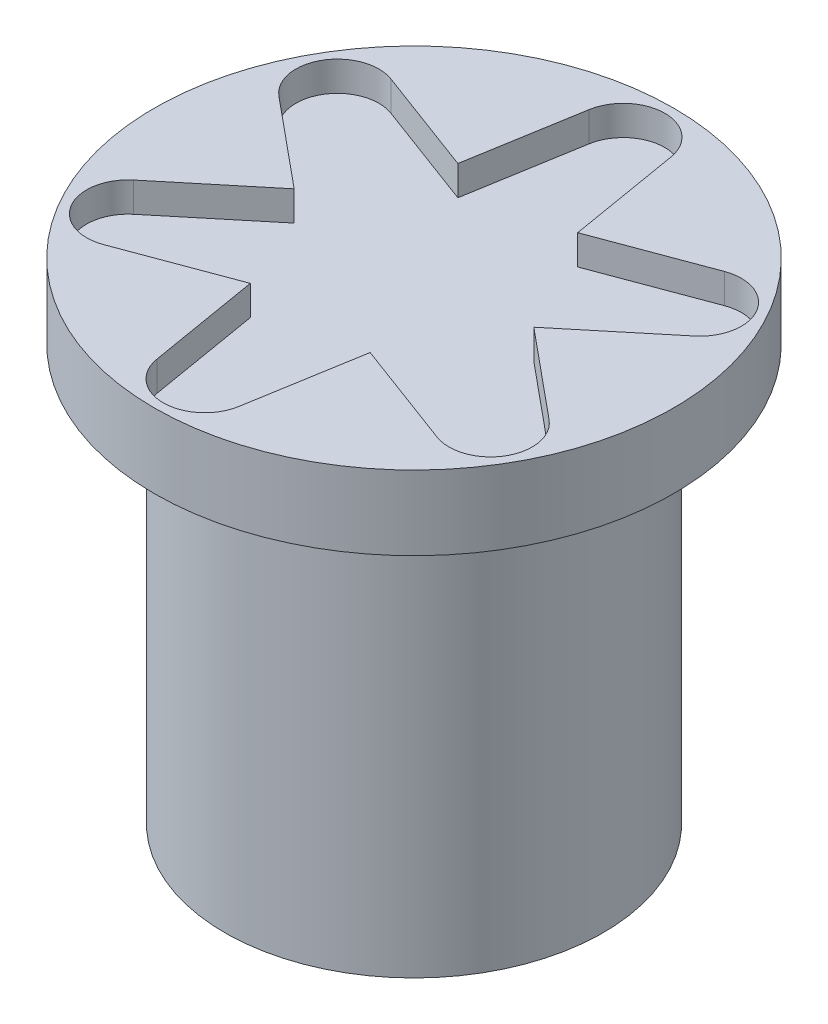
from build123d import *

# Parameters (mm, degrees)
BOSS_EXTRUDE1_DEPTH = 3
BOSS_EXTRUDE2_START = 25
BOSS_EXTRUDE2_DEPTH = 25
SKETCH3_R           = 17.5
BOSS_EXTRUDE3_DEPTH = 5
CUT_EXTRUDE1_DEPTH  = 2
CIRPATTERN1_COUNT   = 6


with BuildPart() as part:
    # Sketch1 → Boss-Extrude1 (new body)
    with BuildSketch(Plane(origin=(0, 0, 0), x_dir=(1, 0, 0), z_dir=(0, 1, 0))):
        with BuildLine():
            Line((4, 12.106300013), (4, 7.782191208))
            ThreePointArc((4, 7.782191208), (-6.187184335, 6.187184335), (-7.782191208, -4))
            Line((-7.782191208, -4), (-12.106300013, -4))
            ThreePointArc((-12.106300013, -4), (9.01561146, -9.01561146), (4, 12.106300013))
        make_face()
        with BuildLine():
            Line((-2, 3.8), (2, 3.8))
            ThreePointArc((2, 3.8), (5.8, 0), (2, -3.8))
            Line((2, -3.8), (-2, -3.8))
            ThreePointArc((-2, -3.8), (-5.8, 0), (-2, 3.8))
        make_face(mode=Mode.SUBTRACT)
    extrude(amount=-BOSS_EXTRUDE1_DEPTH)

    # Sketch2 → Boss-Extrude2 (add)
    with BuildSketch(Plane(origin=(0, 0, 0), x_dir=(1, 0, 0), z_dir=(0, 1, 0)).offset(BOSS_EXTRUDE2_START)):
        with BuildLine():
            Line((-8.891709622, -4), (-12.106300013, -4))
            ThreePointArc((-12.106300013, -4), (9.01561146, -9.01561146), (4, 12.106300013))
            Line((4, 12.106300013), (4, 8.891709622))
            ThreePointArc((4, 8.891709622), (6.894291117, -6.894291117), (-8.891709622, -4))
        make_face()
    extrude(amount=-BOSS_EXTRUDE2_DEPTH)

    # Sketch3 → Boss-Extrude3 (add)
    with BuildSketch(Plane(origin=(0, 25, 0), x_dir=(1, 0, 0), z_dir=(0, 1, 0))):
        Circle(SKETCH3_R)
    extrude(amount=BOSS_EXTRUDE3_DEPTH)

    # Sketch4 → Cut-Extrude1 (cut)
    with BuildSketch(Plane(origin=(0, 30, 0), x_dir=(1, 0, 0), z_dir=(0, 1, 0))):
        with BuildLine():
            Line((-2.761058064, 14.565358319), (-4.097301236, 6.637177305))
            ThreePointArc((-4.097301236, 6.637177305), (0, -7.8), (4.097301236, 6.637177305))
            Line((4.097301236, 6.637177305), (2.761058064, 14.565358319))
            ThreePointArc((2.761058064, 14.565358319), (0, 16.9), (-2.761058064, 14.565358319))
        make_face()
    cut_extrude1 = extrude(amount=-CUT_EXTRUDE1_DEPTH, mode=Mode.SUBTRACT)

    # CirPattern1: Cut-Extrude1 ×6 about axis
    cirpattern1_axis = Axis((0, 28, 0), (0, 1, 0))
    for i in range(1, CIRPATTERN1_COUNT):
        add(cut_extrude1.rotate(cirpattern1_axis, i * 360 / CIRPATTERN1_COUNT), mode=Mode.SUBTRACT)


solid = part.part
